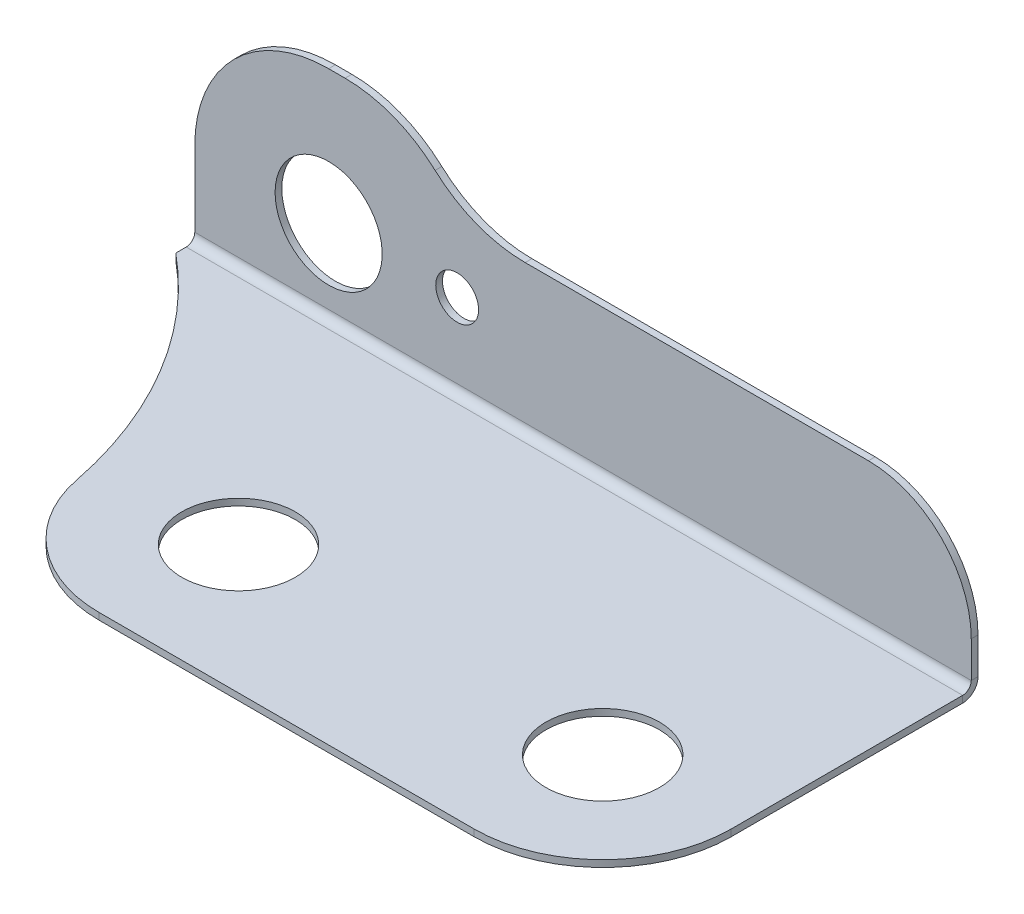
from build123d import *

# Parameters (mm, degrees)
SKETCH1_R                    = 3.3655
BOSS_EXTRUDE1_DEPTH          = 1.524
SKETCH2_R                    = 3.3655
CUT_EXTRUDE1_DEPTH           = 1.524
CUT_EXTRUDE1_DRAFT           = 46
CUT_EXTRUDE1_PROFILE_2_DEPTH = 1.524
CUT_EXTRUDE1_PROFILE_2_DRAFT = 46
FILLET1_R                    = 25.4
SKETCH3_W                    = 15.875
SKETCH3_H                    = 1.524
BOSS_EXTRUDE2_DEPTH          = 11.7475
FILLET3_R                    = 7.9375
SKETCH5_W                    = 30.1625
SKETCH5_H                    = 1.524
BOSS_EXTRUDE3_DEPTH          = 7.62
SKETCH4_R                    = 3.175
SKETCH4_R_2                  = 1.27
CUT_EXTRUDE2_DEPTH           = 19.05
FILLET7_R                    = 7.62
FILLET10_R                   = 6.096
FILLET13_R                   = 7.9375
FILLET14_R                   = 7.9375
CONVERT_SOLID1_START         = -0.62672976
CONVERT_SOLID1_OUTLINE_R     = 3.3655
CONVERT_SOLID1_DEPTH         = 12.37422976
CONVERT_SOLID1_START_2       = -1.124
CONVERT_SOLID1_2_OUTLINE_R   = 3.3655
CONVERT_SOLID1_2_DEPTH       = 0.508
CONVERT_SOLID1_START_3       = -1.524
CONVERT_SOLID1_3_OUTLINE_R   = 3.3655
CONVERT_SOLID1_3_DEPTH       = 0.4
CONVERT_SOLID1_START_4       = -27.6225
CONVERT_SOLID1_4_DEPTH       = 46.0375


with BuildPart() as part:
    # Sketch1 → Boss-Extrude1 (new body)
    with BuildSketch(Plane(origin=(0, 0, 0), x_dir=(1, 0, 0), z_dir=(0, 1, 0))):
        Polygon((-27.6225, 14.6328892), (-27.6225, 13.1088892), (-18.415, 6.7588892), (-18.415, -7.62), (18.415, -7.62), (18.415, 14.6328892), align=None)
        with Locations(Location((-10.795, 0, 0), (0, 0, 270))):
            Circle(SKETCH1_R, mode=Mode.SUBTRACT)
        with Locations(Location((10.795, 0, 0), (0, 0, 270))):
            Circle(SKETCH1_R, mode=Mode.SUBTRACT)
    extrude(amount=-BOSS_EXTRUDE1_DEPTH)


with BuildPart() as cut_extrude1_tool:
    # Sketch2 → Cut-Extrude1 (with draft: the straight prism first)
    with BuildSketch(Plane.XZ.offset(1.524)):
        with Locations((-10.795, 0)):
            Circle(SKETCH2_R)
    extrude(amount=-CUT_EXTRUDE1_DEPTH)
    # Cut-Extrude1: the draft: its side faces are tilted about the plane it starts from
    cut_extrude1_sides = [cut_extrude1_tool.faces().sort_by_distance(p)[0] for p in [
        (-14.1605, -0.762, 0),
    ]]
    draft(cut_extrude1_sides, Plane.XZ.offset(1.524), CUT_EXTRUDE1_DRAFT)


with BuildPart() as part_1:
    add(part.part)

    # Cut-Extrude1: cut by cut_extrude1_tool
    add(cut_extrude1_tool.part, mode=Mode.SUBTRACT)


with BuildPart() as cut_extrude1_profile_2_tool:
    # Sketch2 → Cut-Extrude1 profile 2 (with draft: the straight prism first)
    with BuildSketch(Plane.XZ.offset(1.524)):
        with Locations((10.795, 0)):
            Circle(SKETCH2_R)
    extrude(amount=-CUT_EXTRUDE1_PROFILE_2_DEPTH)
    # Cut-Extrude1 profile 2: the draft: its side faces are tilted about the plane it starts from
    cut_extrude1_profile_2_sides = [cut_extrude1_profile_2_tool.faces().sort_by_distance(p)[0] for p in [
        (7.4295, -0.762, 0),
    ]]
    draft(cut_extrude1_profile_2_sides, Plane.XZ.offset(1.524), CUT_EXTRUDE1_PROFILE_2_DRAFT)


with BuildPart() as part_2:
    add(part_1.part)

    # Cut-Extrude1 profile 2: cut by cut_extrude1_profile_2_tool
    add(cut_extrude1_profile_2_tool.part, mode=Mode.SUBTRACT)

    # Fillet1
    # the kernel refuses this fillet: 25.4 mm, written as the material it adds along each edge
    with BuildSketch(Plane(origin=(-18.415, 0, -6.7588892), x_dir=(0, 0, 1), z_dir=(0, -1, 0))) as fillet1_piece_1:
        with BuildLine():
            CenterArc((13.219439025, 25.4), FILLET1_R, 219.605652394, 50.394347606)
            Line((-6.35, 9.2075), (-6.74138878, 8.88365))
            ThreePointArc((-6.74138878, 8.88365), (-3.593192095, 4.315341658), (-0.418192095, -0.288408342))
            Line((-0.418192095, -0.288408342), (0, -0.508))
            Line((0, -0.508), (13.219439025, -0.508))
            Line((13.219439025, -0.508), (13.219439025, 0))
        make_face()
    extrude(amount=1.524)

    # Sketch3 → Boss-Extrude2 (add)
    with BuildSketch(Plane(origin=(0, 0, 0), x_dir=(1, 0, 0), z_dir=(0, 1, 0))):
        with Locations((-19.685, 13.8708892)):
            Rectangle(SKETCH3_W, SKETCH3_H)
    extrude(amount=BOSS_EXTRUDE2_DEPTH)

    # Fillet3
    fillet3_edges = [part_2.edges().sort_by_distance(p)[0] for p in [
        (-27.6225, 11.7475, -13.8708892),
    ]]
    fillet(fillet3_edges, radius=FILLET3_R)

    # Sketch5 → Boss-Extrude3 (add)
    with BuildSketch(Plane(origin=(0, 0, 0), x_dir=(1, 0, 0), z_dir=(0, 1, 0))):
        with Locations((3.33375, 13.8708892)):
            Rectangle(SKETCH5_W, SKETCH5_H)
    extrude(amount=BOSS_EXTRUDE3_DEPTH)

    # Sketch4 → Cut-Extrude2 (cut)
    with BuildSketch(Plane.XY.offset(-13.1088892)):
        with Locations((-19.685, 3.81)):
            Circle(SKETCH4_R)
        with Locations((-12.065, 3.81)):
            Circle(SKETCH4_R_2)
    extrude(amount=-CUT_EXTRUDE2_DEPTH, mode=Mode.SUBTRACT)

    # Fillet7
    fillet7_edges = [part_2.edges().sort_by_distance(p)[0] for p in [
        (18.415, -0.762, 7.62),
        (-18.415, -0.762, 7.62),
    ]]
    fillet(fillet7_edges, radius=FILLET7_R)

    # Fillet10
    fillet10_edges = [part_2.edges().sort_by_distance(p)[0] for p in [
        (18.415, 7.62, -13.8708892),
    ]]
    fillet(fillet10_edges, radius=FILLET10_R)

    # Fillet13
    # the kernel refuses this fillet: 7.9375 mm, written as the material it takes off along each edge
    with BuildSketch(Plane(origin=(-11.7475, 11.7475, -32.041185758), x_dir=(0, -1, 0), z_dir=(0, 0, 1))) as fillet13_piece_1:
        with BuildLine():
            CenterArc((7.9375, -6.963318623), FILLET13_R, 118.685402014, 61.314597986)
            Line((0, -6.963318623), (-0.15875, -6.963318623))
            Line((-0.15875, -6.963318623), (-0.15875, 0))
            Line((-0.15875, 0), (0, 0.15875))
            ThreePointArc((0, 0.15875), (2.06375, 0.15875), (4.0513, 0.139266372))
            Line((4.0513, 0.139266372), (4.1275, 0))
        make_face()
    extrude(amount=36.340593117, mode=Mode.SUBTRACT)

    # Fillet14
    fillet14_edges = [part_2.edges().sort_by_distance(p)[0] for p in [
        (-11.7475, 7.62, -13.8708892),
    ]]
    fillet(fillet14_edges, radius=FILLET14_R)

    # Convert-Solid1: read off the stored shape, not the designer's step
    # Convert-Solid1 outline → Convert-Solid1 (cut)
    with BuildSketch(Plane(origin=(0, 0, 0), x_dir=(1, 0, 0), z_dir=(0, 1, 0)).offset(CONVERT_SOLID1_START)):
        with BuildLine():
            Line((18.415, 14.2328892), (-27.6225, 14.2328892))
            Line((-27.6225, 14.2328892), (-27.6225, 13.1088892))
            ThreePointArc((-27.6225, 13.1088892), (-22.006205533, 6.560067822), (-18.905914469, -1.490896113))
            ThreePointArc((-18.905914469, -1.490896113), (-16.265567707, -5.891732699), (-11.43318881, -7.62))
            Line((-11.43318881, -7.62), (10.795, -7.62))
            ThreePointArc((10.795, -7.62), (16.183153673, -5.388153673), (18.415, 0))
            Line((18.415, 0), (18.415, 14.2328892))
        make_face()
        with Locations((10.795, 0)):
            Circle(CONVERT_SOLID1_OUTLINE_R, mode=Mode.SUBTRACT)
        with Locations((-10.795, 0)):
            Circle(CONVERT_SOLID1_OUTLINE_R, mode=Mode.SUBTRACT)
    extrude(amount=CONVERT_SOLID1_DEPTH, mode=Mode.SUBTRACT)

    # Convert-Solid1 2 outline → Convert-Solid1 2 (cut)
    with BuildSketch(Plane(origin=(0, 0, 0), x_dir=(1, 0, 0), z_dir=(0, 1, 0)).offset(CONVERT_SOLID1_START_2)):
        with BuildLine():
            Line((18.415, 0), (18.415, 13.1088892))
            Line((18.415, 13.1088892), (-27.6225, 13.1088892))
            ThreePointArc((-27.6225, 13.1088892), (-22.006205533, 6.560067822), (-18.905914469, -1.490896113))
            ThreePointArc((-18.905914469, -1.490896113), (-16.265567707, -5.891732699), (-11.43318881, -7.62))
            Line((-11.43318881, -7.62), (10.795, -7.62))
            ThreePointArc((10.795, -7.62), (16.183153673, -5.388153673), (18.415, 0))
        make_face()
        with Locations((-10.795, 0)):
            Circle(CONVERT_SOLID1_2_OUTLINE_R, mode=Mode.SUBTRACT)
        with Locations((10.795, 0)):
            Circle(CONVERT_SOLID1_2_OUTLINE_R, mode=Mode.SUBTRACT)
    extrude(amount=CONVERT_SOLID1_2_DEPTH, mode=Mode.SUBTRACT)

    # Convert-Solid1 3 outline → Convert-Solid1 3 (add)
    with BuildSketch(Plane(origin=(0, 0, 0), x_dir=(1, 0, 0), z_dir=(0, 1, 0)).offset(CONVERT_SOLID1_START_3)):
        with BuildLine():
            Line((18.415, 0), (18.415, 13.1088892))
            Line((18.415, 13.1088892), (-27.6225, 13.1088892))
            ThreePointArc((-27.6225, 13.1088892), (-22.006205533, 6.560067822), (-18.905914469, -1.490896113))
            ThreePointArc((-18.905914469, -1.490896113), (-16.265567707, -5.891732699), (-11.43318881, -7.62))
            Line((-11.43318881, -7.62), (10.795, -7.62))
            ThreePointArc((10.795, -7.62), (16.183153673, -5.388153673), (18.415, 0))
        make_face()
        with Locations((-10.795, 0)):
            Circle(CONVERT_SOLID1_3_OUTLINE_R, mode=Mode.SUBTRACT)
        with Locations((10.795, 0)):
            Circle(CONVERT_SOLID1_3_OUTLINE_R, mode=Mode.SUBTRACT)
    extrude(amount=CONVERT_SOLID1_3_DEPTH)

    # Convert-Solid1 4 outline → Convert-Solid1 4 (cut)
    with BuildSketch(Plane.YZ.offset(CONVERT_SOLID1_START_4)):
        with BuildLine():
            ThreePointArc((-0.62672976, -14.632825801), (-1.261835359, -14.36313734), (-1.524, -13.7248892))
            Line((-1.524, -13.7248892), (-1.524000001, -13.1088892))
            Line((-1.524000001, -13.1088892), (-3, -13.1088892))
            Line((-3, -13.1088892), (-3, -16))
            Line((-3, -16), (-0.62672976, -16))
            Line((-0.62672976, -16), (-0.62672976, -14.632825801))
        make_face()
        with BuildLine():
            Line((-0.62672976, -13.1088892), (-1.124, -13.1088892))
            Line((-1.124, -13.1088892), (-1.124, -13.7248892))
            ThreePointArc((-1.124, -13.7248892), (-0.978983965, -14.080285656), (-0.62672976, -14.232775873))
            Line((-0.62672976, -14.232775873), (-0.62672976, -13.1088892))
        make_face()
    extrude(amount=CONVERT_SOLID1_4_DEPTH, mode=Mode.SUBTRACT)


solid = part_2.part
